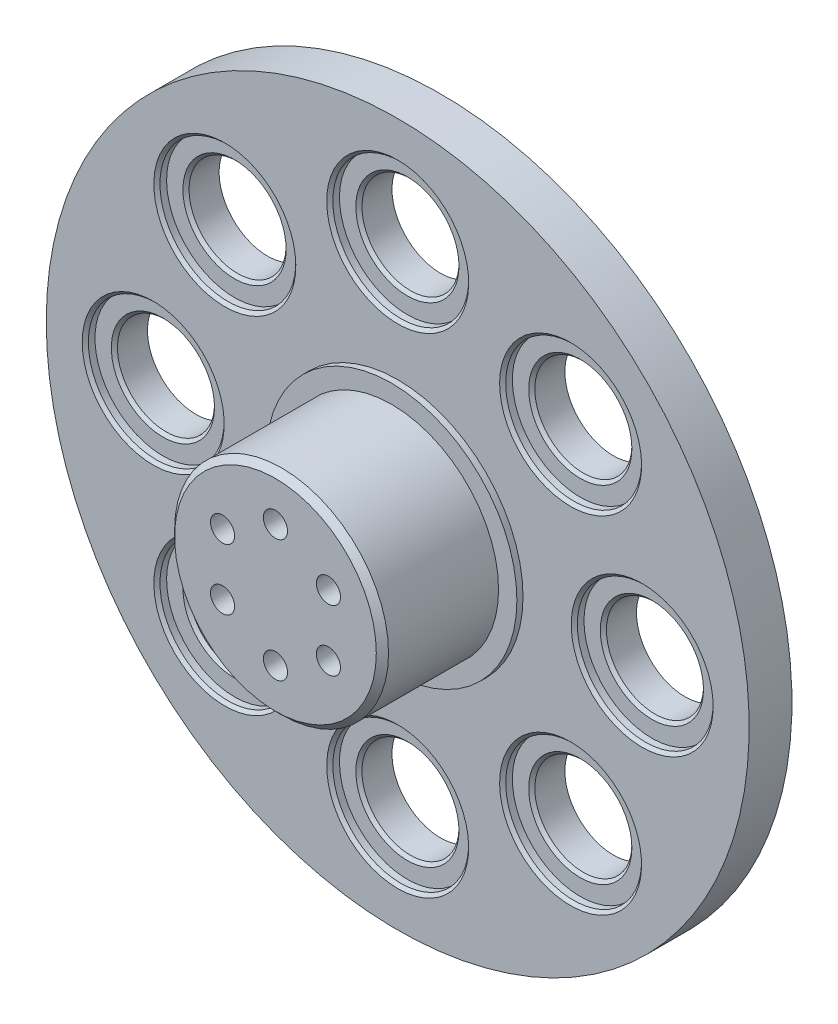
from build123d import *

# Parameters (mm, degrees)
SKETCH1_R                    = 17.5
BOSS_EXTRUDE1_DEPTH          = 19
SKETCH7_R                    = 20.5
BOSS_EXTRUDE3_DEPTH          = 1
SKETCH3_R                    = 57.5
BOSS_EXTRUDE2_DEPTH          = 7
SKETCH4_R                    = 11
CUT_EXTRUDE1_DEPTH           = 7
SKETCH5_R                    = 7.5
CUT_EXTRUDE2_DEPTH           = 0.5
SKETCH6_R                    = 1.975
CUT_EXTRUDE3_DEPTH           = 10
CIRPATTERN1_COUNT            = 6
CHAMFER1_SIZE                = 1
SKETCH8_R                    = 7.94
CUT_EXTRUDE4_DEPTH           = 84.740671122
SKETCH9_R                    = 11.1125
CUT_EXTRUDE5_DEPTH           = 1.5875
CHAMFER2_SIZE                = 0.5
CHAMFER3_SIZE                = 0.5
CIRPATTERN2_COUNT            = 8
CHAMFER2_OF_CIRPATTERN2_SIZE = 0.5
CHAMFER3_OF_CIRPATTERN2_SIZE = 0.5


with BuildPart() as part:
    # Sketch1 → Boss-Extrude1 (new body)
    with BuildSketch(Plane.XY):
        Circle(SKETCH1_R)
    extrude(amount=BOSS_EXTRUDE1_DEPTH)

    # Sketch7 → Boss-Extrude3 (add)
    with BuildSketch(Plane(origin=(0, 0, 0), x_dir=(-1, 0, 0), z_dir=(0, 0, -1))):
        Circle(SKETCH7_R)
    extrude(amount=BOSS_EXTRUDE3_DEPTH)

    # Sketch3 → Boss-Extrude2 (add)
    with BuildSketch(Plane(origin=(0, 0, -1), x_dir=(-1, 0, 0), z_dir=(0, 0, -1))):
        Circle(SKETCH3_R)
    extrude(amount=BOSS_EXTRUDE2_DEPTH)

    # Sketch4 → Cut-Extrude1 (cut)
    with BuildSketch(Plane(origin=(0, 0, -8), x_dir=(-1, 0, 0), z_dir=(0, 0, -1))):
        Circle(SKETCH4_R)
    extrude(amount=-CUT_EXTRUDE1_DEPTH, mode=Mode.SUBTRACT)

    # Sketch5 → Cut-Extrude2 (cut)
    with BuildSketch(Plane(origin=(0, 0, -1), x_dir=(-1, 0, 0), z_dir=(0, 0, -1))):
        Circle(SKETCH5_R)
    extrude(amount=-CUT_EXTRUDE2_DEPTH, mode=Mode.SUBTRACT)

    # Sketch6 → Cut-Extrude3 (cut)
    with BuildSketch(Plane.XY.offset(19)):
        with Locations((0, 10)):
            Circle(SKETCH6_R)
    cut_extrude3 = extrude(amount=-CUT_EXTRUDE3_DEPTH, mode=Mode.SUBTRACT)

    # CirPattern1: Cut-Extrude3 ×6 about axis
    cirpattern1_axis = Axis((0, 0, 19), (0, 0, 1))
    for i in range(1, CIRPATTERN1_COUNT):
        add(cut_extrude3.rotate(cirpattern1_axis, i * 360 / CIRPATTERN1_COUNT), mode=Mode.SUBTRACT)

    # Chamfer1
    chamfer1_edges = [part.edges().sort_by_distance(p)[0] for p in [
        (11, 0, -8),
        (-17.5, 0, 19),
    ]]
    chamfer(chamfer1_edges, length=CHAMFER1_SIZE)

    # Sketch8 → Cut-Extrude4 (cut, through all)
    with BuildSketch(Plane.XY.offset(-1)):
        with Locations((-40, 0)):
            Circle(SKETCH8_R)
    cut_extrude4 = extrude(amount=-CUT_EXTRUDE4_DEPTH, mode=Mode.SUBTRACT)

    # Sketch9 → Cut-Extrude5 (cut)
    with BuildSketch(Plane.XY.offset(-1)):
        with Locations((-40, 0)):
            Circle(SKETCH9_R)
    cut_extrude5 = extrude(amount=-CUT_EXTRUDE5_DEPTH, mode=Mode.SUBTRACT)

    # Chamfer2
    chamfer2_edges = [part.edges().sort_by_distance(p)[0] for p in [
        (-47.94, 0, -2.5875),
    ]]
    chamfer(chamfer2_edges, length=CHAMFER2_SIZE)

    # Chamfer3
    chamfer3_edges = [part.edges().sort_by_distance(p)[0] for p in [
        (-51.1125, 0, -1),
    ]]
    chamfer(chamfer3_edges, length=CHAMFER3_SIZE)

    # CirPattern2: Cut-Extrude4, Cut-Extrude5 ×8 about axis
    cirpattern2_axis = Axis((0, 0, -1), (0, 0, -1))
    add([cut_extrude4.rotate(cirpattern2_axis, i * 360 / CIRPATTERN2_COUNT) for i in range(1, CIRPATTERN2_COUNT)], mode=Mode.SUBTRACT)
    add([cut_extrude5.rotate(cirpattern2_axis, i * 360 / CIRPATTERN2_COUNT) for i in range(1, CIRPATTERN2_COUNT)], mode=Mode.SUBTRACT)

    # Chamfer2 of CirPattern2
    chamfer2_of_cirpattern2_edges = [part.edges().sort_by_distance(p)[0] for p in [
        (-33.89869909, 33.89869909, -2.5875),
        (0, 47.94, -2.5875),
        (33.89869909, 33.89869909, -2.5875),
        (47.94, 0, -2.5875),
        (33.89869909, -33.89869909, -2.5875),
        (0, -47.94, -2.5875),
        (-33.89869909, -33.89869909, -2.5875),
    ]]
    chamfer(chamfer2_of_cirpattern2_edges, length=CHAMFER2_OF_CIRPATTERN2_SIZE)

    # Chamfer3 of CirPattern2
    chamfer3_of_cirpattern2_edges = [part.edges().sort_by_distance(p)[0] for p in [
        (-36.141995353, 36.141995353, -1),
        (0, 51.1125, -1),
        (36.141995353, 36.141995353, -1),
        (51.1125, 0, -1),
        (36.141995353, -36.141995353, -1),
        (0, -51.1125, -1),
        (-36.141995353, -36.141995353, -1),
    ]]
    chamfer(chamfer3_of_cirpattern2_edges, length=CHAMFER3_OF_CIRPATTERN2_SIZE)


solid = part.part
